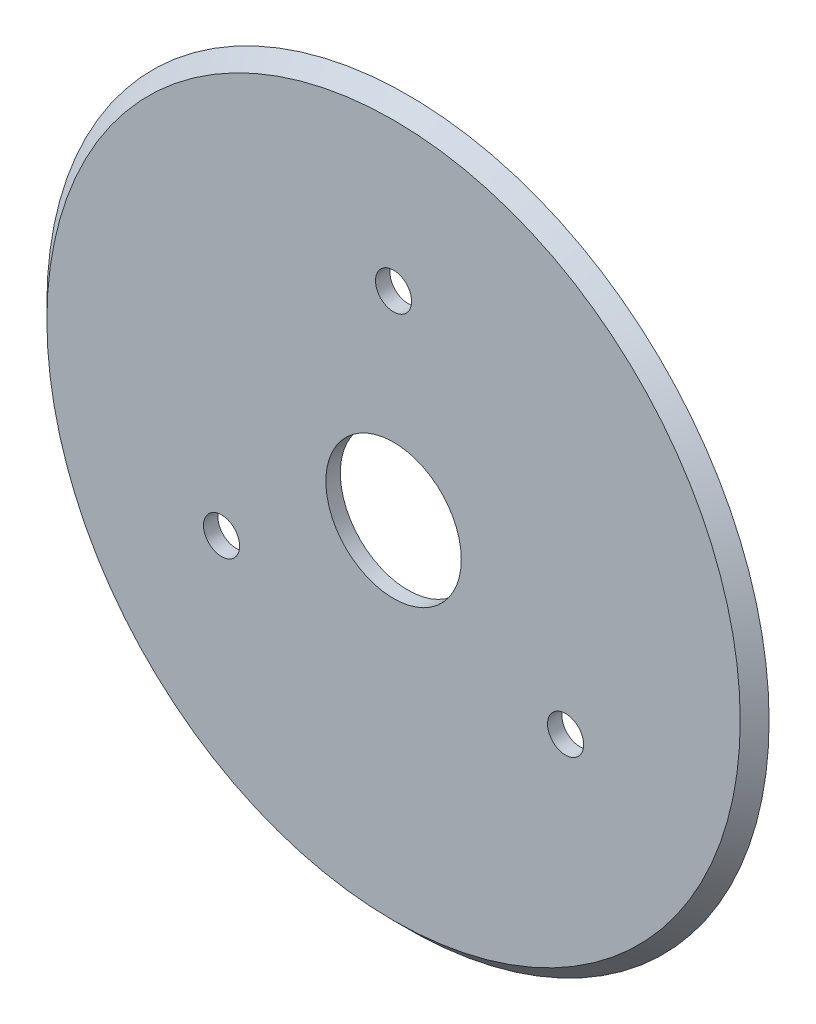
from build123d import *

# Parameters (mm, degrees)
SKETCH1_R           = 40
BOSS_EXTRUDE1_DEPTH = 1.6
SKETCH2_R           = 7.5
SKETCH2_R_2         = 2
CUT_EXTRUDE1_DEPTH  = 1.6
CHAMFER1_SIZE       = 1.6


with BuildPart() as part:
    # Sketch1 → Boss-Extrude1 (new body)
    with BuildSketch(Plane.XY):
        Circle(SKETCH1_R)
    extrude(amount=BOSS_EXTRUDE1_DEPTH)

    # Sketch2 → Cut-Extrude1 (cut)
    with BuildSketch(Plane.XY.offset(1.6)):
        Circle(SKETCH2_R)
        with Locations((0, 22)):
            Circle(SKETCH2_R_2)
        with Locations((19.052558883, -11)):
            Circle(SKETCH2_R_2)
        with Locations((-19.052558883, -11)):
            Circle(SKETCH2_R_2)
    extrude(amount=-CUT_EXTRUDE1_DEPTH, mode=Mode.SUBTRACT)

    # Chamfer1
    chamfer1_edges = [part.edges().sort_by_distance(p)[0] for p in [
        (-40, 0, 1.6),
    ]]
    chamfer(chamfer1_edges, length=CHAMFER1_SIZE - 0.0001)  # a hair under: the kernel refuses the full size


solid = part.part
